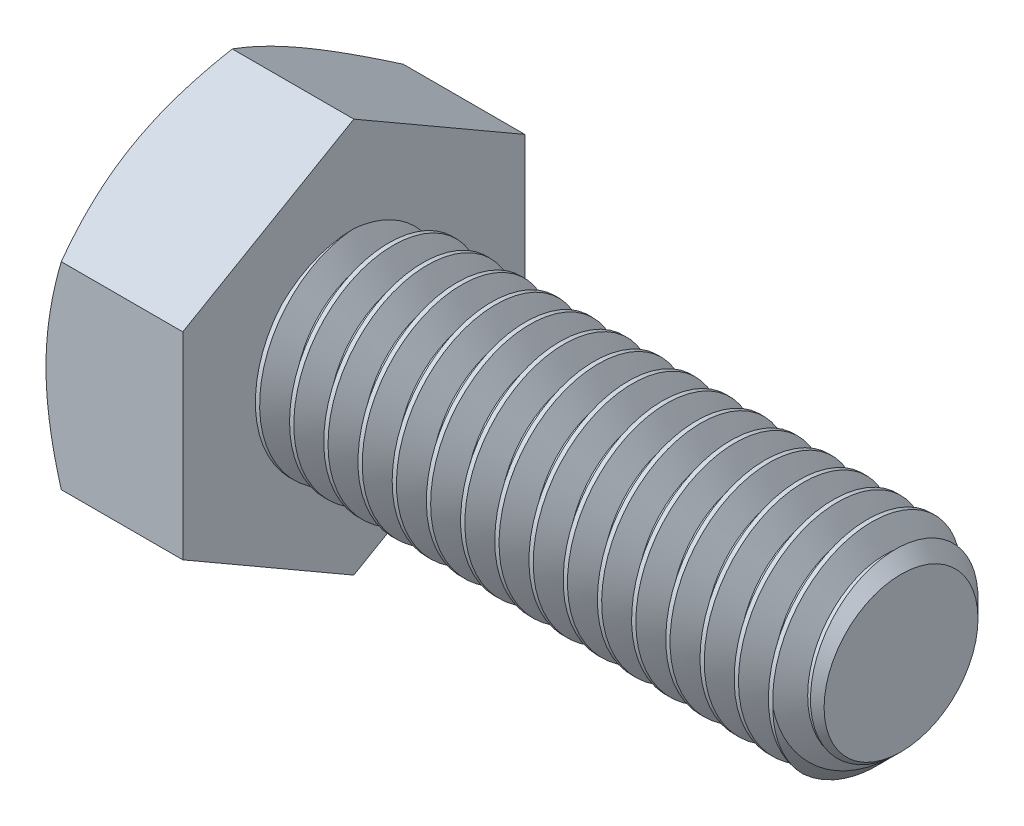
from build123d import *

# Parameters (mm, degrees)
SKETCH2_R           = 3
BOSS_EXTRUDE1_DEPTH = 16
CHAMFER1_SIZE       = 0.75
CUT_SWEEP1_PITCH    = 1
BOSS_EXTRUDE2_DEPTH = 4
SKETCH6_OUTSIDE_W   = 94.66
SKETCH6_OUTSIDE_H   = 96.208
SKETCH6_OUTSIDE_R   = 5
CUT_EXTRUDE1_DEPTH  = 22.408721108
CUT_EXTRUDE1_DRAFT  = -60


with BuildPart() as part:
    # Sketch2 → Boss-Extrude1 (new body)
    with BuildSketch(Plane(origin=(10, 0, 0), x_dir=(0, 0, -1), z_dir=(1, 0, 0))):
        Circle(SKETCH2_R)
    extrude(amount=-BOSS_EXTRUDE1_DEPTH)

    # Chamfer1
    chamfer1_edges = [part.edges().sort_by_distance(p)[0] for p in [
        (10, 0, 3),
    ]]
    chamfer(chamfer1_edges, length=CHAMFER1_SIZE)

    # Cut-Sweep1: the profile of Sketch5 profile screwed along a right-hand helix of 17 turns, 8 arcs to a turn; built about Z, then put on its axis
    cut_sweep1_z = Axis((0, 0, 0), (0, 0, 1))
    cut_sweep1_corners = [(3.0003, 0, 0.000173205), (2.350480947, 0, -0.375), (2.350480947, 0, -0.5), (3.0003, 0, -0.875173205)]
    with BuildLine(mode=Mode.PRIVATE) as cut_sweep1_profile:
        Line(cut_sweep1_corners[0], cut_sweep1_corners[1])
        Line(cut_sweep1_corners[1], cut_sweep1_corners[2])
        Line(cut_sweep1_corners[2], cut_sweep1_corners[3])
        Line(cut_sweep1_corners[3], cut_sweep1_corners[0])
    cut_sweep1_cap = Face(cut_sweep1_profile.wire())
    cut_sweep1_turn_angles = [0, 22.5, 45, 67.5, 90, 112.5, 135, 157.5, 180, 202.5, 225, 247.5, 270, 292.5, 315, 337.5, 360]
    cut_sweep1_turn_weights = [1, 0.9238795325112867, 1, 0.9238795325112867, 1, 0.9238795325112867, 1, 0.9238795325112867, 1, 0.9238795325112867, 1, 0.9238795325112867, 1, 0.9238795325112867, 1, 0.9238795325112867, 1]
    cut_sweep1_turn_rails = [Edge.make_bspline([Vector(p[0], p[1], 0).rotate(cut_sweep1_z, cut_sweep1_turn_angles[k]) / cut_sweep1_turn_weights[k] + Vector(0, 0, p[2] + CUT_SWEEP1_PITCH * cut_sweep1_turn_angles[k] / 360) for k in range(17)], [0, 0, 0, 1, 1, 2, 2, 3, 3, 4, 4, 5, 5, 6, 6, 7, 7, 8, 8, 8], 2, cut_sweep1_turn_weights) for p in cut_sweep1_corners]
    cut_sweep1_turn_sides = [Face.make_surface_from_curves(cut_sweep1_turn_rails[p[0]], cut_sweep1_turn_rails[p[1]]) for p in [(0, 1), (1, 2), (2, 3), (3, 0)]]
    cut_sweep1 = Plane(origin=(10, 0, 0), x_dir=(0, 1, 0), z_dir=(-1, 0, 0)) * Solid(Shell([*[p.moved(Location((0, 0, CUT_SWEEP1_PITCH * i))) for i in range(17) for p in cut_sweep1_turn_sides], cut_sweep1_cap, cut_sweep1_cap.rotate(cut_sweep1_z, 6120).moved(Location((0, 0, CUT_SWEEP1_PITCH * 6120 / 360)))]))
    add(cut_sweep1, mode=Mode.SUBTRACT)

    # Sketch3 → Boss-Extrude2 (add)
    with BuildSketch(Plane.ZY.offset(6)):
        Polygon((-5, -2.886751346), (0, -5.773502692), (5, -2.886751346), (5, 2.886751346), (0, 5.773502692), (-5, 2.886751346), align=None)
    extrude(amount=BOSS_EXTRUDE2_DEPTH)


with BuildPart() as cut_extrude1_tool:
    # Sketch6 outside → Cut-Extrude1 (with draft: the straight prism first)
    with BuildSketch(Plane.ZY.offset(10)):
        Rectangle(SKETCH6_OUTSIDE_W, SKETCH6_OUTSIDE_H)
        Circle(SKETCH6_OUTSIDE_R, mode=Mode.SUBTRACT)
    extrude(amount=-CUT_EXTRUDE1_DEPTH)
    # Cut-Extrude1: the draft: its side faces are tilted about the plane it starts from
    cut_extrude1_sides = [cut_extrude1_tool.faces().sort_by_distance(p)[0] for p in [
        (1.204360554, -48.104, 0),
        (1.204360554, 0, 47.33),
        (1.204360554, 48.104, 0),
        (1.204360554, 0, -47.33),
        (1.204360554, 0, -5),
    ]]
    draft(cut_extrude1_sides, Plane.ZY.offset(10), CUT_EXTRUDE1_DRAFT)


with BuildPart() as part_1:
    add(part.part)

    # Cut-Extrude1: cut by cut_extrude1_tool
    add(cut_extrude1_tool.part, mode=Mode.SUBTRACT)


solid = part_1.part
